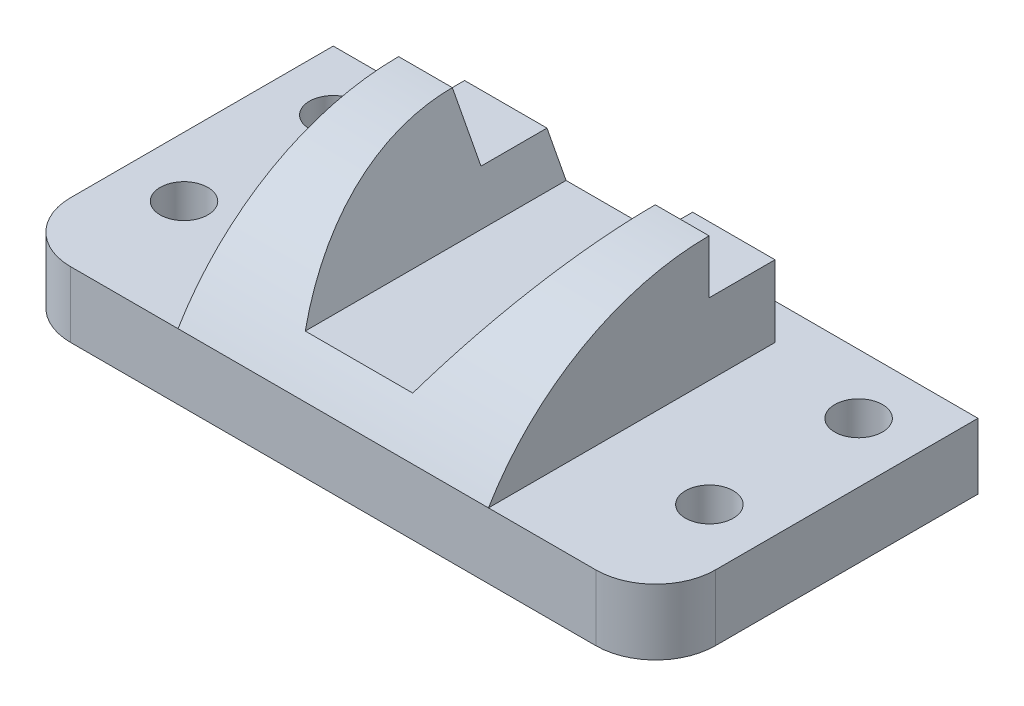
from build123d import *

# Parameters (mm, degrees)
SKETCH1_W                      = 108
SKETCH1_H                      = 54
SKETCH1_R                      = 4
BOSS_EXTRUDE3_DEPTH            = 11
BOSS_EXTRUDE4_DEPTH            = 26
CUT_EXTRUDE1_REACH             = 70.33
CUT_EXTRUDE1_DIRECTION_2_REACH = 70.33
FILLET1_R                      = 10


with BuildPart() as part:
    # Sketch1 → Boss-Extrude3 (new body)
    with BuildSketch(Plane(origin=(0, 0, 0), x_dir=(1, 0, 0), z_dir=(0, 1, 0))):
        Rectangle(SKETCH1_W, SKETCH1_H)
        with Locations((-44, -8)):
            Circle(SKETCH1_R, mode=Mode.SUBTRACT)
        with Locations((-44, 17)):
            Circle(SKETCH1_R, mode=Mode.SUBTRACT)
        with Locations((44, 17)):
            Circle(SKETCH1_R, mode=Mode.SUBTRACT)
        with Locations((44, -8)):
            Circle(SKETCH1_R, mode=Mode.SUBTRACT)
    extrude(amount=BOSS_EXTRUDE3_DEPTH)

    # Sketch4 → Boss-Extrude4 (add, symmetric)
    with BuildSketch(Plane(origin=(0, 0, 0), x_dir=(0, 0, -1), z_dir=(1, 0, 0))):
        with BuildLine():
            Line((9.945906404, 32), (9.945906404, 23))
            Line((9.945906404, 23), (21, 23))
            Line((21, 23), (21, 11))
            Line((21, 11), (-27, 11))
            ThreePointArc((-27, 11), (-11.302622957, 26.383151285), (9.945906404, 32))
        make_face()
    extrude(amount=BOSS_EXTRUDE4_DEPTH, both=True)

    # Sketch5 → Cut-Extrude1 (cut, up to next)
    with BuildSketch(Plane.XY, mode=Mode.PRIVATE) as cut_extrude1_sk1:
        Polygon((-17, 32), (-9, 17), (9, 17), (17, 32), align=None)
    cut_extrude1_tool1 = extrude(cut_extrude1_sk1.sketch, amount=-CUT_EXTRUDE1_REACH, mode=Mode.PRIVATE) & part.part
    add(cut_extrude1_tool1.solids().sort_by_distance((0, 25.269231, 0))[0], mode=Mode.SUBTRACT)

    # Sketch5 → Cut-Extrude1 direction 2 (cut, up to next)
    with BuildSketch(Plane.XY, mode=Mode.PRIVATE) as cut_extrude1_direction_2_sk1:
        Polygon((-17, 32), (-9, 17), (9, 17), (17, 32), align=None)
    cut_extrude1_direction_2_tool1 = extrude(cut_extrude1_direction_2_sk1.sketch, amount=CUT_EXTRUDE1_DIRECTION_2_REACH, mode=Mode.PRIVATE) & part.part
    add(cut_extrude1_direction_2_tool1.solids().sort_by_distance((0, 25.269231, 0))[0], mode=Mode.SUBTRACT)

    # Fillet1
    fillet1_edges = [part.edges().sort_by_distance(p)[0] for p in [
        (-54, 5.5, 27),
        (54, 5.5, 27),
    ]]
    fillet(fillet1_edges, radius=FILLET1_R)


solid = part.part
